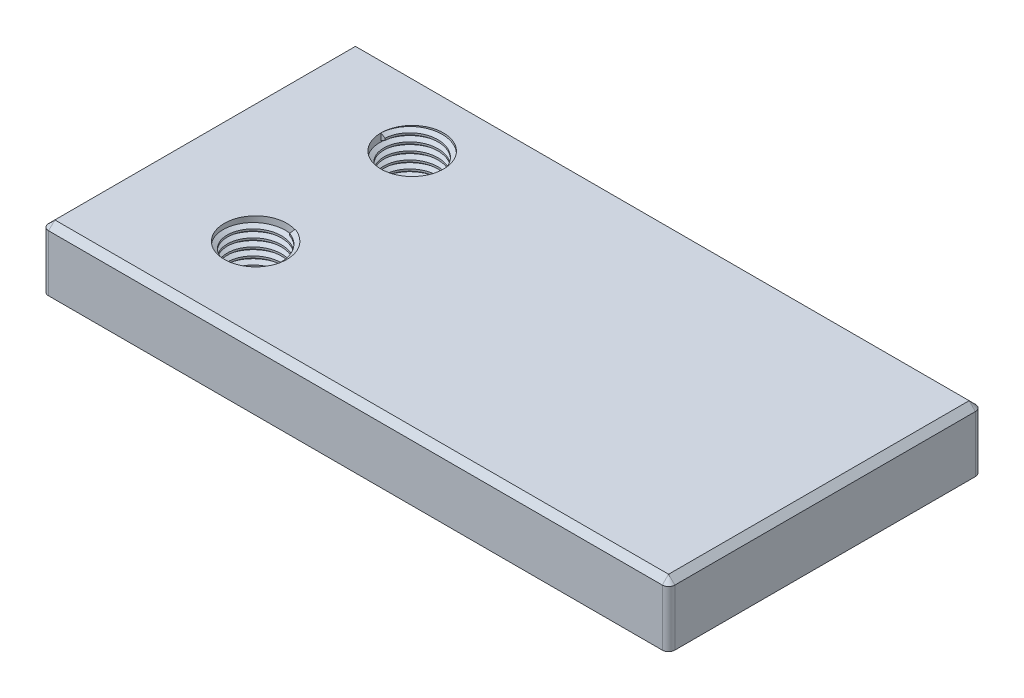
from build123d import *
from build123d.topology import SkipClean

# Parameters (mm, degrees)
SALIENTE_EXTRUIR1_DEPTH = 10
CHAFL_N1_SIZE           = 1
CROQUIS3_R              = 5
CORTAR_EXTRUIR1_DEPTH   = 10
ROSCA1_PITCH            = 1.25
ROSCA3_PITCH            = 1.25


with BuildPart() as part:
    # Croquis1 → Saliente-Extruir1 (new body)
    with BuildSketch(Plane(origin=(0, 0, 0), x_dir=(1, 0, 0), z_dir=(0, 1, 0))):
        with BuildLine():
            Line((-49, 25), (49, 25))
            ThreePointArc((49, 25), (49.707106781, 24.707106781), (50, 24))
            Line((50, 24), (50, -24))
            ThreePointArc((50, -24), (49.707106781, -24.707106781), (49, -25))
            Line((49, -25), (-49, -25))
            ThreePointArc((-49, -25), (-49.707106781, -24.707106781), (-50, -24))
            Line((-50, -24), (-50, 24))
            ThreePointArc((-50, 24), (-49.707106781, 24.707106781), (-49, 25))
        make_face()
    extrude(amount=SALIENTE_EXTRUIR1_DEPTH)

    # Chaflán1
    chafl_n1_edges = [part.edges().sort_by_distance(p)[0] for p in [
        (-49.707106781, 10, -24.707106781),
        (-50, 10, 0),
        (-49.707106781, 10, 24.707106781),
        (0, 10, 25),
        (49.707106781, 10, 24.707106781),
        (50, 10, 0),
        (49.707106781, 10, -24.707106781),
        (0, 10, -25),
    ]]
    chamfer(chafl_n1_edges, length=CHAFL_N1_SIZE)

    # Croquis3 → Cortar-Extruir1 (cut)
    with BuildSketch(Plane(origin=(0, 10, 0), x_dir=(1, 0, 0), z_dir=(0, 1, 0))):
        with Locations(Location((-30, 14.061978649, 0), (0, 0, 270))):
            Circle(CROQUIS3_R)
        with Locations(Location((-30, -10.938021351, 0), (0, 0, 270))):
            Circle(CROQUIS3_R)
    extrude(amount=-CORTAR_EXTRUIR1_DEPTH, mode=Mode.SUBTRACT)

    # Rosca1: the profile of Perfil de rosca1 profile screwed along a right-hand helix of 7.2 turns, 8 arcs to a turn; built about Z, then put on its axis
    with SkipClean():  # the faces are left unmerged after this step: merging them gives an invalid solid
        rosca1_z = Axis((0, 0, 0), (0, 0, 1))
        rosca1_corners = [(5.0003, 0, -0.000173205), (5.0003, 0, 1.093923202), (4.323417656, 0, 0.703124998), (4.323417656, 0, 0.390624998)]
        with BuildLine(mode=Mode.PRIVATE) as rosca1_profile:
            Line(rosca1_corners[0], rosca1_corners[1])
            Line(rosca1_corners[1], rosca1_corners[2])
            Line(rosca1_corners[2], rosca1_corners[3])
            Line(rosca1_corners[3], rosca1_corners[0])
        rosca1_cap = Face(rosca1_profile.wire())
        rosca1_turn_angles = [0, 22.5, 45, 67.5, 90, 112.5, 135, 157.5, 180, 202.5, 225, 247.5, 270, 292.5, 315, 337.5, 360]
        rosca1_turn_weights = [1, 0.9238795325112867, 1, 0.9238795325112867, 1, 0.9238795325112867, 1, 0.9238795325112867, 1, 0.9238795325112867, 1, 0.9238795325112867, 1, 0.9238795325112867, 1, 0.9238795325112867, 1]
        rosca1_turn_rails = [Edge.make_bspline([Vector(p[0], p[1], 0).rotate(rosca1_z, rosca1_turn_angles[k]) / rosca1_turn_weights[k] + Vector(0, 0, p[2] + ROSCA1_PITCH * rosca1_turn_angles[k] / 360) for k in range(17)], [0, 0, 0, 1, 1, 2, 2, 3, 3, 4, 4, 5, 5, 6, 6, 7, 7, 8, 8, 8], 2, rosca1_turn_weights) for p in rosca1_corners]
        rosca1_turn_sides = [Face.make_surface_from_curves(rosca1_turn_rails[p[0]], rosca1_turn_rails[p[1]]) for p in [(0, 1), (1, 2), (2, 3), (3, 0)]]
        rosca1_last_angles = [2520, 2542.5, 2565, 2578.5, 2592]
        rosca1_last_weights = [1, 0.9238795325112867, 1, 0.9723699203976766, 1]
        rosca1_last_rails = [Edge.make_bspline([Vector(p[0], p[1], 0).rotate(rosca1_z, rosca1_last_angles[k]) / rosca1_last_weights[k] + Vector(0, 0, p[2] + ROSCA1_PITCH * rosca1_last_angles[k] / 360) for k in range(5)], [0, 0, 0, 1, 1, 2, 2, 2], 2, rosca1_last_weights) for p in rosca1_corners]
        rosca1_last_sides = [Face.make_surface_from_curves(rosca1_last_rails[p[0]], rosca1_last_rails[p[1]]) for p in [(0, 1), (1, 2), (2, 3), (3, 0)]]
        rosca1 = Plane(origin=(-30, 0, 10.938021351), x_dir=(1, 0, 0), z_dir=(0, 1, 0)) * Solid(Shell([*[p.moved(Location((0, 0, ROSCA1_PITCH * i))) for i in range(7) for p in rosca1_turn_sides], *rosca1_last_sides, rosca1_cap, rosca1_cap.rotate(rosca1_z, 2592).moved(Location((0, 0, ROSCA1_PITCH * 2592 / 360)))]))
        add(rosca1)

    # Rosca3: the profile of Perfil de rosca3 profile screwed along a right-hand helix of 7.2 turns, 8 arcs to a turn; built about Z, then put on its axis
    rosca3_z = Axis((0, 0, 0), (0, 0, 1))
    rosca3_corners = [(5.0003, 0, -0.000173205), (5.0003, 0, 1.093923202), (4.323417656, 0, 0.703124998), (4.323417656, 0, 0.390624998)]
    with BuildLine(mode=Mode.PRIVATE) as rosca3_profile:
        Line(rosca3_corners[0], rosca3_corners[1])
        Line(rosca3_corners[1], rosca3_corners[2])
        Line(rosca3_corners[2], rosca3_corners[3])
        Line(rosca3_corners[3], rosca3_corners[0])
    rosca3_cap = Face(rosca3_profile.wire())
    rosca3_turn_angles = [0, 22.5, 45, 67.5, 90, 112.5, 135, 157.5, 180, 202.5, 225, 247.5, 270, 292.5, 315, 337.5, 360]
    rosca3_turn_weights = [1, 0.9238795325112867, 1, 0.9238795325112867, 1, 0.9238795325112867, 1, 0.9238795325112867, 1, 0.9238795325112867, 1, 0.9238795325112867, 1, 0.9238795325112867, 1, 0.9238795325112867, 1]
    rosca3_turn_rails = [Edge.make_bspline([Vector(p[0], p[1], 0).rotate(rosca3_z, rosca3_turn_angles[k]) / rosca3_turn_weights[k] + Vector(0, 0, p[2] + ROSCA3_PITCH * rosca3_turn_angles[k] / 360) for k in range(17)], [0, 0, 0, 1, 1, 2, 2, 3, 3, 4, 4, 5, 5, 6, 6, 7, 7, 8, 8, 8], 2, rosca3_turn_weights) for p in rosca3_corners]
    rosca3_turn_sides = [Face.make_surface_from_curves(rosca3_turn_rails[p[0]], rosca3_turn_rails[p[1]]) for p in [(0, 1), (1, 2), (2, 3), (3, 0)]]
    rosca3_last_angles = [2520, 2542.5, 2565, 2578.5, 2592]
    rosca3_last_weights = [1, 0.9238795325112867, 1, 0.9723699203976766, 1]
    rosca3_last_rails = [Edge.make_bspline([Vector(p[0], p[1], 0).rotate(rosca3_z, rosca3_last_angles[k]) / rosca3_last_weights[k] + Vector(0, 0, p[2] + ROSCA3_PITCH * rosca3_last_angles[k] / 360) for k in range(5)], [0, 0, 0, 1, 1, 2, 2, 2], 2, rosca3_last_weights) for p in rosca3_corners]
    rosca3_last_sides = [Face.make_surface_from_curves(rosca3_last_rails[p[0]], rosca3_last_rails[p[1]]) for p in [(0, 1), (1, 2), (2, 3), (3, 0)]]
    rosca3 = Plane(origin=(-30, 10, -14.061978649), x_dir=(-1, 0, 0), z_dir=(0, -1, 0)) * Solid(Shell([*[p.moved(Location((0, 0, ROSCA3_PITCH * i))) for i in range(7) for p in rosca3_turn_sides], *rosca3_last_sides, rosca3_cap, rosca3_cap.rotate(rosca3_z, 2592).moved(Location((0, 0, ROSCA3_PITCH * 2592 / 360)))]))
    add(rosca3)


solid = part.part
